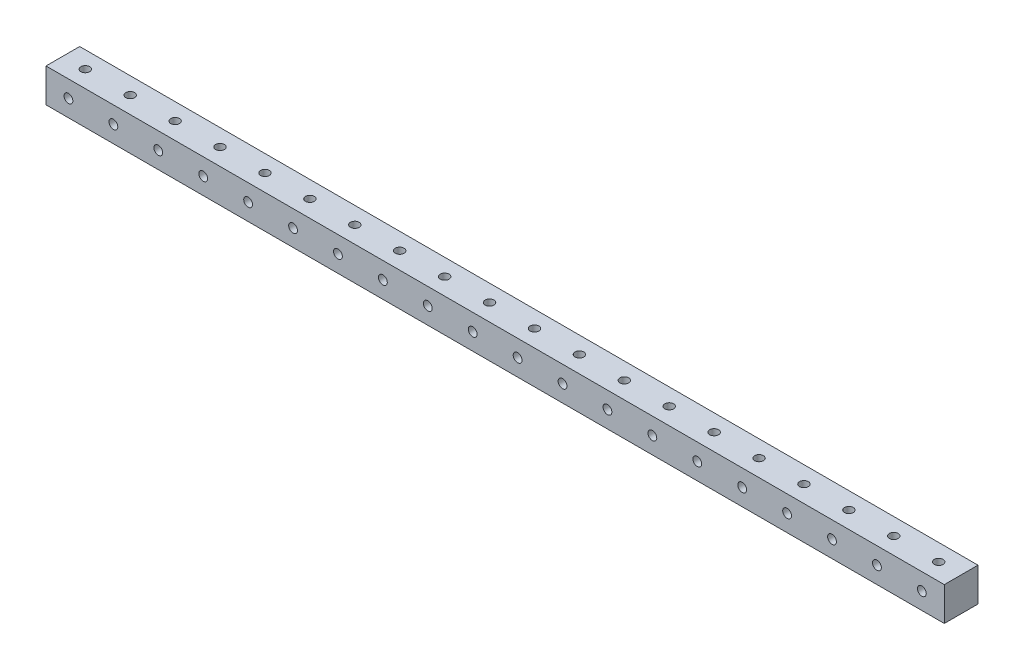
from build123d import *

# Parameters (mm, degrees)
SKETCH1_W             = 19.05
SKETCH1_H             = 19.05
BOSS_EXTRUDE1_DEPTH   = 254
SKETCH3_W             = 2.4892
SKETCH3_H             = 19.05
SKETCH3_AT_POINT_2_W  = 2.4892
SKETCH3_AT_POINT_2_H  = 19.05
LPATTERN1_START       = -11
LPATTERN1_OUTLINE_R   = 2.4892
LPATTERN1_DEPTH       = 22
LPATTERN1_2_OUTLINE_R = 2.4892
LPATTERN1_2_DEPTH     = 22


with BuildPart() as part:
    # Sketch1 → Boss-Extrude1 (new, symmetric)
    with BuildSketch(Plane(origin=(0, 0, 0), x_dir=(0, 0, -1), z_dir=(1, 0, 0))):
        Rectangle(SKETCH1_W, SKETCH1_H)
    extrude(amount=BOSS_EXTRUDE1_DEPTH, both=True)

    # Sketch3 → #9 (0.196) Diameter Hole1 (revolve, cut)
    with BuildSketch(Plane(origin=(241.3, 9.525, 0), x_dir=(0, 0, 1), z_dir=(1, 0, 0))):
        with Locations((1.2446, 9.525)):
            Rectangle(SKETCH3_W, SKETCH3_H)
    revolve(axis=Axis((241.3, 15.875, 0), (0, -1, 0)), mode=Mode.SUBTRACT)

    # Sketch3 at point 2 (carried to point 2, square into its face) → #9 (0.196) Diameter Hole1 at 2 (revolve, cut)
    with BuildSketch(Plane(origin=(241.3, 0, 9.525), x_dir=(0, -1, 0), z_dir=(1, 0, 0))):
        with Locations((1.2446, 9.525)):
            Rectangle(SKETCH3_AT_POINT_2_W, SKETCH3_AT_POINT_2_H)
    revolve(axis=Axis((241.3, 0, 15.875), (0, 0, -1)), mode=Mode.SUBTRACT)

    # LPattern1: read off the stored shape, not the designer's step
    # LPattern1 outline → LPattern1 (cut)
    with BuildSketch(Plane.XY.offset(LPATTERN1_START)):
        with Locations((-241.3, 0)):
            Circle(LPATTERN1_OUTLINE_R)
        with Locations((-215.9, 0)):
            Circle(LPATTERN1_OUTLINE_R)
        with Locations((-190.5, 0)):
            Circle(LPATTERN1_OUTLINE_R)
        with Locations((-165.1, 0)):
            Circle(LPATTERN1_OUTLINE_R)
        with Locations((-139.7, 0)):
            Circle(LPATTERN1_OUTLINE_R)
        with Locations((-114.3, 0)):
            Circle(LPATTERN1_OUTLINE_R)
        with Locations((-88.9, 0)):
            Circle(LPATTERN1_OUTLINE_R)
        with Locations((-63.5, 0)):
            Circle(LPATTERN1_OUTLINE_R)
        with Locations((-38.1, 0)):
            Circle(LPATTERN1_OUTLINE_R)
        with Locations((-12.7, 0)):
            Circle(LPATTERN1_OUTLINE_R)
        with Locations((12.7, 0)):
            Circle(LPATTERN1_OUTLINE_R)
        with Locations((38.1, 0)):
            Circle(LPATTERN1_OUTLINE_R)
        with Locations((63.5, 0)):
            Circle(LPATTERN1_OUTLINE_R)
        with Locations((88.9, 0)):
            Circle(LPATTERN1_OUTLINE_R)
        with Locations((114.3, 0)):
            Circle(LPATTERN1_OUTLINE_R)
        with Locations((139.7, 0)):
            Circle(LPATTERN1_OUTLINE_R)
        with Locations((165.1, 0)):
            Circle(LPATTERN1_OUTLINE_R)
        with Locations((190.5, 0)):
            Circle(LPATTERN1_OUTLINE_R)
        with Locations((215.9, 0)):
            Circle(LPATTERN1_OUTLINE_R)
    extrude(amount=LPATTERN1_DEPTH, mode=Mode.SUBTRACT)

    # LPattern1 2 outline → LPattern1 2 (cut)
    with BuildSketch(Plane(origin=(0, 0, 0), x_dir=(1, 0, 0), z_dir=(0, 1, 0)).offset(LPATTERN1_START)):
        with Locations((215.9, 0)):
            Circle(LPATTERN1_2_OUTLINE_R)
        with Locations((190.5, 0)):
            Circle(LPATTERN1_2_OUTLINE_R)
        with Locations((165.1, 0)):
            Circle(LPATTERN1_2_OUTLINE_R)
        with Locations((139.7, 0)):
            Circle(LPATTERN1_2_OUTLINE_R)
        with Locations((114.3, 0)):
            Circle(LPATTERN1_2_OUTLINE_R)
        with Locations((88.9, 0)):
            Circle(LPATTERN1_2_OUTLINE_R)
        with Locations((63.5, 0)):
            Circle(LPATTERN1_2_OUTLINE_R)
        with Locations((38.1, 0)):
            Circle(LPATTERN1_2_OUTLINE_R)
        with Locations((12.7, 0)):
            Circle(LPATTERN1_2_OUTLINE_R)
        with Locations((-12.7, 0)):
            Circle(LPATTERN1_2_OUTLINE_R)
        with Locations((-38.1, 0)):
            Circle(LPATTERN1_2_OUTLINE_R)
        with Locations((-63.5, 0)):
            Circle(LPATTERN1_2_OUTLINE_R)
        with Locations((-88.9, 0)):
            Circle(LPATTERN1_2_OUTLINE_R)
        with Locations((-114.3, 0)):
            Circle(LPATTERN1_2_OUTLINE_R)
        with Locations((-139.7, 0)):
            Circle(LPATTERN1_2_OUTLINE_R)
        with Locations((-165.1, 0)):
            Circle(LPATTERN1_2_OUTLINE_R)
        with Locations((-190.5, 0)):
            Circle(LPATTERN1_2_OUTLINE_R)
        with Locations((-215.9, 0)):
            Circle(LPATTERN1_2_OUTLINE_R)
        with Locations((-241.3, 0)):
            Circle(LPATTERN1_2_OUTLINE_R)
    extrude(amount=LPATTERN1_2_DEPTH, mode=Mode.SUBTRACT)


solid = part.part
